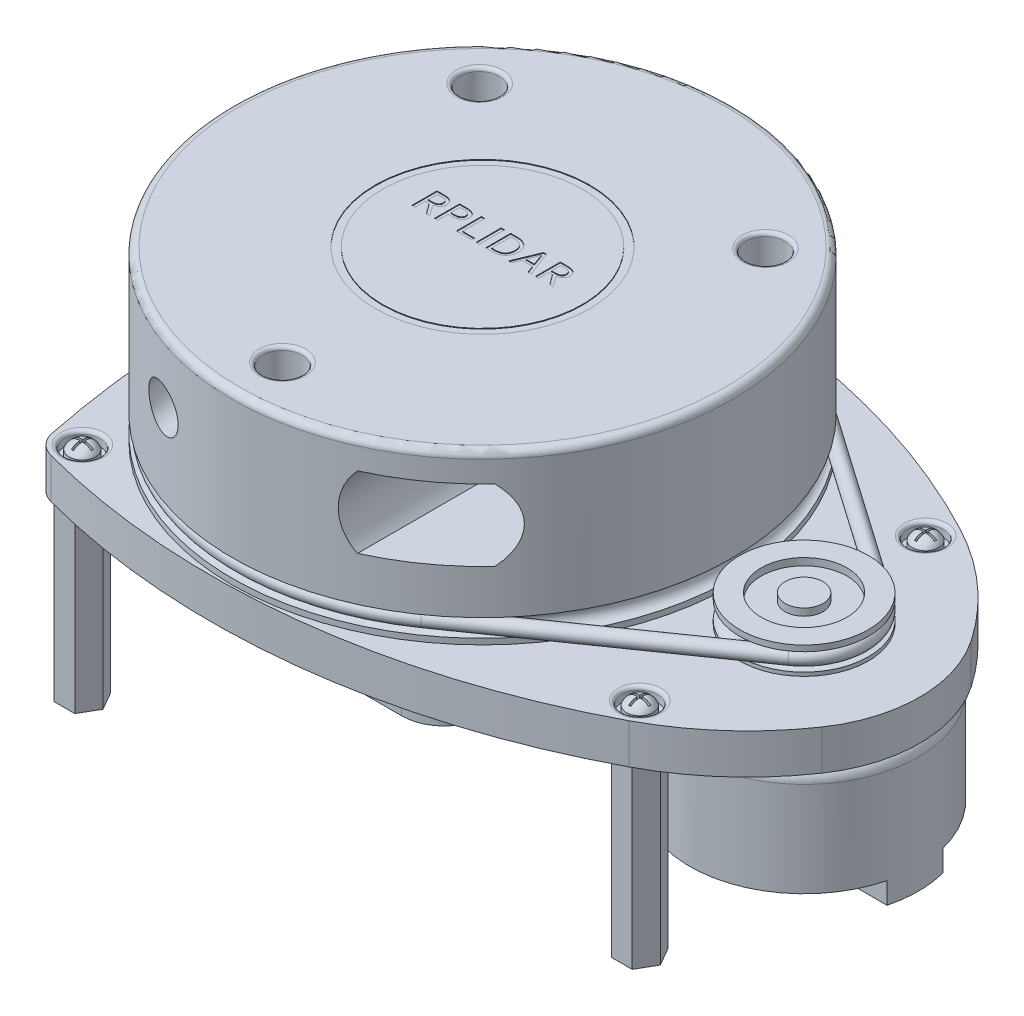
from build123d import *
from build123d.topology import SkipClean

# Parameters (mm, degrees)
SKETCH1_R                   = 35
PUCK_DEPTH                  = 23.5
FILLET1_R                   = 1
CUT_SENSOR_TUNNEL_DEPTH     = 55.792791624
BOSS_BOARD_START            = -0.5
BOSS_BOARD_DEPTH            = 5.6
HEX_STANDOFFS_DEPTH         = 25
SKETCH23_R                  = 2.5
SCREW_SEATS_DEPTH           = 1.5
FILLET_SCREW_SEATS_R        = 0.5
CUT_EXTRUDE5_START          = -0.5
CUT_EXTRUDE5_DEPTH          = 2
SKETCH6_R                   = 16
MOTOR_BODY_DEPTH            = 15
SKETCH9_R                   = 30
MOULD_BOTTOM_DISC_DEPTH     = 3.3
SKETCH10_W                  = 46
SKETCH10_H                  = 57
BOSS_CIRCUIT_DEPTH          = 1.1
FILLET_CIRCUIT_BOARD_R      = 6
SWEEP_BAND_PROFILE_R        = 1
FILLET3_R                   = 1.75
SKETCH18_R                  = 2.75
TOP_PUCK_HOLES_DEPTH        = 8
FILLET_PUCK_HOLES_R         = 0.5
SKETCH19_R                  = 15
SKETCH19_R_2                = 13.98
TOP_RING_AESTHETIC_DEPTH    = 0.1
SKETCH28_W                  = 0.443661972
SKETCH28_H                  = 3.5
RPLIDAR_TEXT_DEPTH          = 0.1
MOTOR_PLASTIC_FEATURE_DEPTH = 3
SKETCH31_R                  = 3.5
CUT_OPTICS_DEPTH            = 78.034465357
CUT_OPTICS_TAPER            = 1
SKETCH37_R                  = 1.25
DRILL_STANDOFFS_DEPTH       = 10


with BuildPart() as part:
    # Sketch1 → puck (new body)
    with BuildSketch(Plane(origin=(0, 0, 0), x_dir=(1, 0, 0), z_dir=(0, 1, 0))):
        Circle(SKETCH1_R)
    extrude(amount=PUCK_DEPTH)

    # Fillet1
    fillet1_edges = [part.edges().sort_by_distance(p)[0] for p in [
        (-35, 23.5, 0),
    ]]
    fillet(fillet1_edges, radius=FILLET1_R)

    # Sketch2 → groove (revolve, cut)
    with BuildSketch(Plane.XY):
        with BuildLine():
            Line((-35, 3.3), (-35, 0.8))
            ThreePointArc((-35, 0.8), (-33.75, 2.05), (-35, 3.3))
        make_face()
    revolve(axis=Axis((0, 0, 0), (0, 1, 0)), mode=Mode.SUBTRACT)

    # Sketch3 → cut_sensor_tunnel (cut, through all)
    with BuildSketch(Plane.XY):
        with BuildLine():
            Line((14.409830056, 19.5), (25.590169944, 19.5))
            ThreePointArc((25.590169944, 19.5), (27.5, 14.5), (25.590169944, 9.5))
            Line((25.590169944, 9.5), (14.409830056, 9.5))
            ThreePointArc((14.409830056, 9.5), (12.5, 14.5), (14.409830056, 19.5))
        make_face()
    extrude(amount=CUT_SENSOR_TUNNEL_DEPTH, mode=Mode.SUBTRACT)



with BuildPart() as body_2:
    # Sketch4 → boss_board (new body)
    with BuildSketch(Plane(origin=(0, 0, 0), x_dir=(1, 0, 0), z_dir=(0, 1, 0)).offset(BOSS_BOARD_START)):
        with BuildLine():
            ThreePointArc((-28.9265577, 31.478719711), (8.165815302, 34.200883889), (43.687550184, 23.179964524))
            ThreePointArc((43.687550184, 23.179964524), (51.581142549, 17.68138932), (57.933651773, 10.457210733))
            ThreePointArc((57.933651773, 10.457210733), (61.172696898, 0), (57.933651773, -10.457210733))
            ThreePointArc((57.933651773, -10.457210733), (51.581142549, -17.68138932), (43.687550184, -23.179964524))
            ThreePointArc((43.687550184, -23.179964524), (8.165815302, -34.200883889), (-28.9265577, -31.478719711))
            ThreePointArc((-28.9265577, -31.478719711), (-30.621991293, -30.466812044), (-31.528712871, -28.712871287))
            ThreePointArc((-31.528712871, -28.712871287), (-34.4, 0), (-31.528712871, 28.712871287))
            ThreePointArc((-31.528712871, 28.712871287), (-30.621991293, 30.466812044), (-28.9265577, 31.478719711))
        make_face()
    extrude(amount=-BOSS_BOARD_DEPTH)

    # Sketch5 → hex_standoffs (add)
    with BuildSketch(Plane.XZ.offset(6.1)):
        Polygon((-26.556624327, 30.5), (-29.443375673, 30.5), (-30.886751346, 28), (-29.443375673, 25.5), (-26.556624327, 25.5), (-25.113248654, 28), align=None)
        Polygon((-26.556624327, -25.5), (-29.443375673, -25.5), (-30.886751346, -28), (-29.443375673, -30.5), (-26.556624327, -30.5), (-25.113248654, -28), align=None)
        Polygon((43.443375673, 22.5), (40.556624327, 22.5), (39.113248654, 20), (40.556624327, 17.5), (43.443375673, 17.5), (44.886751346, 20), align=None)
        Polygon((43.443375673, -17.5), (40.556624327, -17.5), (39.113248654, -20), (40.556624327, -22.5), (43.443375673, -22.5), (44.886751346, -20), align=None)
    extrude(amount=HEX_STANDOFFS_DEPTH)

    # Sketch23 → screw_seats (cut)
    with BuildSketch(Plane(origin=(0, -0.5, 0), x_dir=(1, 0, 0), z_dir=(0, 1, 0))):
        with Locations((-28, 28)):
            Circle(SKETCH23_R)
        with Locations((42, 20)):
            Circle(SKETCH23_R)
        with Locations((42, -20)):
            Circle(SKETCH23_R)
        with Locations((-28, -28)):
            Circle(SKETCH23_R)
    extrude(amount=-SCREW_SEATS_DEPTH, mode=Mode.SUBTRACT)

    # fillet_screw_seats
    fillet_screw_seats_edges = [body_2.edges().sort_by_distance(p)[0] for p in [
        (-30.5, -0.5, 28),
        (39.5, -0.5, 20),
        (39.5, -0.5, -20),
        (-30.5, -0.5, -28),
    ]]
    fillet(fillet_screw_seats_edges, radius=FILLET_SCREW_SEATS_R)

    # Sketch24 → revolve_screw_head (revolve)
    with BuildSketch(Plane.YZ.offset(-28)):
        with BuildLine():
            Line((-2, -28), (-2, -26.15))
            Line((-2, -26.15), (-1.041127656, -26.15))
            ThreePointArc((-1.041127656, -26.15), (-0.28319623, -26.795543768), (0, -27.75))
            Line((0, -27.75), (-1, -27.75))
            Line((-1, -27.75), (-1, -28))
            Line((-1, -28), (-2, -28))
        make_face()
    revolve_screw_head = revolve(axis=Axis((-28, -2, -28), (0, 1, 0)))

    # Sketch25 → Cut-Extrude5 (cut)
    with BuildSketch(Plane(origin=(0, -0.5, 0), x_dir=(1, 0, 0), z_dir=(0, 1, 0)).offset(CUT_EXTRUDE5_START)):
        Polygon((-27.85, 28.15), (-26.6, 28.15), (-26.6, 27.85), (-27.85, 27.85), (-27.85, 26.6), (-28.15, 26.6), (-28.15, 27.85), (-29.4, 27.85), (-29.4, 28.15), (-28.15, 28.15), (-28.15, 29.4), (-27.85, 29.4), align=None)
    cut_extrude5 = extrude(amount=CUT_EXTRUDE5_DEPTH, mode=Mode.SUBTRACT)

    # Sketch-Pattern1: revolve_screw_head, Cut-Extrude5 at 3 more places
    with Locations((70, 0, 8), (70, 0, 48), (0, 0, 56)):
        add(revolve_screw_head)
        add(cut_extrude5, mode=Mode.SUBTRACT)

    # Sketch9 → mould_bottom_disc (add)
    with BuildSketch(Plane.XZ.offset(6.1)):
        Circle(SKETCH9_R)
    extrude(amount=MOULD_BOTTOM_DISC_DEPTH)

    # Sketch10 → boss_circuit (add)
    with BuildSketch(Plane.XZ.offset(9.4)):
        with Locations((0.172696898, 0)):
            Rectangle(SKETCH10_W, SKETCH10_H)
    extrude(amount=BOSS_CIRCUIT_DEPTH)

    # fillet_circuit_board
    fillet_circuit_board_edges = [body_2.edges().sort_by_distance(p)[0] for p in [
        (-22.827303102, -9.95, 28.5),
        (23.172696898, -9.95, -28.5),
        (23.172696898, -9.95, 28.5),
        (-22.827303102, -9.95, -28.5),
    ]]
    fillet(fillet_circuit_board_edges, radius=FILLET_CIRCUIT_BOARD_R)


with BuildPart() as body_3:
    # Sketch6 → motor_body (new body)
    with BuildSketch(Plane.XZ.offset(6.1)):
        with Locations((45, 0)):
            Circle(SKETCH6_R)
    extrude(amount=MOTOR_BODY_DEPTH)

    # Fillet3
    fillet3_edges = [body_3.edges().sort_by_distance(p)[0] for p in [
        (29, -6.1, 0),
    ]]
    fillet(fillet3_edges, radius=FILLET3_R)


    with SkipClean():  # the faces are left unmerged after this step: merging them gives an invalid solid
        add(body_2.part)  # motor_plastic_feature merges body 2
        # Sketch30 → motor_plastic_feature (add)
        with BuildSketch(Plane.XZ.offset(21.1)):
            with BuildLine():
                Line((29.482590422, 3.9), (60.517409578, 3.9))
                ThreePointArc((60.517409578, 3.9), (61, 0), (60.517409578, -3.9))
                Line((60.517409578, -3.9), (29.482590422, -3.9))
                ThreePointArc((29.482590422, -3.9), (29, 0), (29.482590422, 3.9))
            make_face()
        extrude(amount=MOTOR_PLASTIC_FEATURE_DEPTH)

    # Sketch37 → drill_standoffs (cut)
    with SkipClean():  # the faces are left unmerged after this step: merging them gives an invalid solid
        with BuildSketch(Plane.XZ.offset(31.1)):
            with Locations((-28, 28)):
                Circle(SKETCH37_R)
            with Locations((42, 20)):
                Circle(SKETCH37_R)
            with Locations((-28, -28)):
                Circle(SKETCH37_R)
            with Locations((42, -20)):
                Circle(SKETCH37_R)
        extrude(amount=-DRILL_STANDOFFS_DEPTH, mode=Mode.SUBTRACT)


with BuildPart() as body_4:
    # Sketch8 → motor_pulley (revolve)
    with BuildSketch(Plane.XY):
        with BuildLine():
            Line((45, 4.1), (47.65, 4.1))
            Line((47.65, 4.1), (47.65, 3.1))
            Line((47.65, 3.1), (51, 3.1))
            Line((51, 3.1), (51, 4.1))
            Line((51, 4.1), (54, 4.1))
            Line((54, 4.1), (54, 3.283896268))
            ThreePointArc((54, 3.283896268), (52.55, 2.05), (54, 0.816103732))
            Line((54, 0.816103732), (54, 0.3))
            Line((54, 0.3), (47, 0.3))
            Line((47, 0.3), (47, 0))
            Line((47, 0), (45, 0))
            Line((45, 0), (45, 4.1))
        make_face()
    revolve(axis=Axis((45, 0, 0), (0, 1, 0)))


with BuildPart() as part_1:
    add(part.part)

    add(body_4.part)  # sweep_band merges body 4
    # sweep_band: sweep along a path in Sketch12
    with BuildLine(Plane(origin=(0, 2.05, 0), x_dir=(1, 0, 0), z_dir=(0, 1, 0))) as sweep_band_path:
        Line((19.3125, 27.678328052), (49.577777778, 6.560788872))
        ThreePointArc((49.577777778, 6.560788872), (53, 0), (49.577777778, -6.560788872))
        Line((49.577777778, -6.560788872), (19.3125, -27.678328052))
        ThreePointArc((19.3125, -27.678328052), (-33.75, 0), (19.3125, 27.678328052))
    # sweep_band profile (on start of the path) → sweep_band (sweep)
    with BuildSketch(Plane(origin=(19.3125, 2.05, -27.678328052), x_dir=(-0.5722222222222224, 0, 0.8200986089459373), z_dir=(0.8200986089459373, 0, 0.5722222222222224))):
        Circle(SWEEP_BAND_PROFILE_R)
    sweep(path=sweep_band_path.line)

    # Sketch18 → top_puck_holes (cut)
    with BuildSketch(Plane(origin=(0, 23.5, 0), x_dir=(1, 0, 0), z_dir=(0, 1, 0))):
        with Locations((-20, 19.595917942)):
            Circle(SKETCH18_R)
        with Locations((20, 19.595917942)):
            Circle(SKETCH18_R)
        with Locations((0, -28)):
            Circle(SKETCH18_R)
    extrude(amount=-TOP_PUCK_HOLES_DEPTH, mode=Mode.SUBTRACT)

    # fillet_puck_holes
    fillet_puck_holes_edges = [part_1.edges().sort_by_distance(p)[0] for p in [
        (-2.75, 23.5, 28),
        (17.25, 23.5, -19.595917942),
        (-22.75, 23.5, -19.595917942),
    ]]
    fillet(fillet_puck_holes_edges, radius=FILLET_PUCK_HOLES_R)

    # Sketch19 → top_ring_aesthetic (cut)
    with BuildSketch(Plane(origin=(0, 23.5, 0), x_dir=(1, 0, 0), z_dir=(0, 1, 0))):
        Circle(SKETCH19_R)
        Circle(SKETCH19_R_2, mode=Mode.SUBTRACT)
    extrude(amount=-TOP_RING_AESTHETIC_DEPTH, mode=Mode.SUBTRACT)

    # Sketch28 → RPLIDAR_text (cut)
    # profile 1 of 7: a face of its own
    with BuildSketch(Plane(origin=(0, 23.5, 0), x_dir=(1, 0, 0), z_dir=(0, 1, 0))):
        with BuildLine():
            Line((-9.518699354, 1.527961963), (-9.518699354, 0.098384498))
            Line((-9.518699354, 0.098384498), (-9.962361326, 0.098384498))
            Line((-9.962361326, 0.098384498), (-9.962361326, 3.598384498))
            Line((-9.962361326, 3.598384498), (-9.047308509, 3.598384498))
            add(Edge.make_bspline(
                [(-9.047308509, 3.598384498), (-9.010074022, 3.598406733), (-8.938406607, 3.59844953), (-8.835454477, 3.594052816), (-8.741143505, 3.589187689), (-8.629287432, 3.578782879), (-8.500608101, 3.562788655), (-8.402690794, 3.538449911), (-8.355627171, 3.526751576)],
                knots=[0, 0, 0, 0, 0.960912573, 1.849525173, 2.659327608, 3.397884282, 4.749301861, 6, 6, 6, 6], degree=3))
            add(Edge.make_bspline(
                [(-8.355627171, 3.526751576), (-8.32571201, 3.518179413), (-8.267044364, 3.501368252), (-8.182896367, 3.46957633), (-8.103929603, 3.433197836), (-8.030296037, 3.392915875), (-7.962477578, 3.347539331), (-7.899900797, 3.298359484), (-7.842624014, 3.244247606), (-7.791107469, 3.185503936), (-7.744719705, 3.123478914), (-7.705062654, 3.05699123), (-7.671385612, 2.987122817), (-7.643138712, 2.913593713), (-7.622839657, 2.835966663), (-7.607231695, 2.754961093), (-7.597863344, 2.669943095), (-7.596737884, 2.61197871), (-7.596164142, 2.582429393)],
                knots=[0, 0, 0, 0, 1.134140113, 2.224201012, 3.275431843, 4.3018668, 5.280587031, 6.24687456, 7.200337623, 8.148687011, 9.092220061, 10.020068992, 10.966198502, 11.917131199, 12.886677412, 13.887177189, 14.922916719, 16, 16, 16, 16], degree=3))
            add(Edge.make_bspline(
                [(-7.596164142, 2.582429393), (-7.596708206, 2.547714782), (-7.597772295, 2.479819302), (-7.611806916, 2.380968231), (-7.631595192, 2.287193362), (-7.66253987, 2.199922672), (-7.699103041, 2.117905917), (-7.743742684, 2.041835659), (-7.794233427, 1.970683492), (-7.852662405, 1.905951816), (-7.916519288, 1.846214648), (-7.98752068, 1.793148169), (-8.063581708, 1.744207137), (-8.146449252, 1.702193788), (-8.234058967, 1.665367549), (-8.326527306, 1.633842921), (-8.423283666, 1.606327376), (-8.490301937, 1.593685972), (-8.52431115, 1.587270942)],
                knots=[0, 0, 0, 0, 1.112196239, 2.175254001, 3.195927694, 4.180088583, 5.138074931, 6.0714415, 7.003609092, 7.93070943, 8.862804307, 9.803008288, 10.769096889, 11.759573608, 12.777920408, 13.814147618, 14.890763399, 16, 16, 16, 16], degree=3))
            Line((-8.52431115, 1.587270942), (-8.52431115, 1.577257738))
            Line((-8.52431115, 1.577257738), (-7.497572593, 0.098384498))
            Line((-7.497572593, 0.098384498), (-7.941234565, 0.098384498))
            Line((-7.941234565, 0.098384498), (-9.008796185, 1.527961963))
            Line((-9.008796185, 1.527961963), (-9.518699354, 1.527961963))
        make_face()
        with BuildLine():
            Line((-9.518699354, 3.204018301), (-9.518699354, 1.92232816))
            Line((-9.518699354, 1.92232816), (-9.108157981, 1.92232816))
            add(Edge.make_bspline(
                [(-9.108157981, 1.92232816), (-9.077604943, 1.922498152), (-9.018543453, 1.92282676), (-8.933504421, 1.924700236), (-8.855482158, 1.929845279), (-8.762988651, 1.936185347), (-8.657718255, 1.950503729), (-8.57830983, 1.972114046), (-8.540486326, 1.982407386)],
                knots=[0, 0, 0, 0, 0.960008608, 1.855774188, 2.671979062, 3.416289568, 4.769337359, 6, 6, 6, 6], degree=3))
            add(Edge.make_bspline(
                [(-8.540486326, 1.982407386), (-8.505942387, 1.994557563), (-8.439057128, 2.01808319), (-8.34806215, 2.067850302), (-8.269714912, 2.127792201), (-8.203968624, 2.197998884), (-8.150750125, 2.279302119), (-8.115648535, 2.373286011), (-8.092041092, 2.477539389), (-8.090124387, 2.550960175), (-8.089121889, 2.589361611)],
                knots=[0, 0, 0, 0, 1.071897366, 2.075447597, 3.025191329, 3.951603983, 4.882559323, 5.852363215, 6.876716796, 8, 8, 8, 8], degree=3))
            add(Edge.make_bspline(
                [(-8.089121889, 2.589361611), (-8.090561573, 2.625176577), (-8.093324599, 2.693912299), (-8.115315241, 2.791166821), (-8.149790048, 2.877951336), (-8.199465913, 2.952805195), (-8.260469502, 3.017205528), (-8.331379953, 3.07260791), (-8.413259495, 3.117993728), (-8.473353824, 3.138682278), (-8.504284741, 3.149330801)],
                knots=[0, 0, 0, 0, 1.140384521, 2.188614501, 3.161159596, 4.10078681, 5.032829337, 5.977325578, 6.958917162, 8, 8, 8, 8], degree=3))
            add(Edge.make_bspline(
                [(-8.504284741, 3.149330801), (-8.53777504, 3.158218463), (-8.609899374, 3.177358833), (-8.706556395, 3.190130518), (-8.794367396, 3.196598844), (-8.870856519, 3.201671854), (-8.956153478, 3.203533834), (-9.015985239, 3.203851826), (-9.047308509, 3.204018301)],
                knots=[0, 0, 0, 0, 1.138118458, 2.451039163, 3.196085275, 4.033155993, 4.970312991, 6, 6, 6, 6], degree=3))
            Line((-9.047308509, 3.204018301), (-9.518699354, 3.204018301))
        make_face(mode=Mode.SUBTRACT)
    # profile 2 of 7: a face of its own
    with BuildSketch(Plane(origin=(0, 23.5, 0), x_dir=(1, 0, 0), z_dir=(0, 1, 0))):
        with BuildLine():
            Line((-6.363769776, 0.098384498), (-6.807431748, 0.098384498))
            Line((-6.807431748, 0.098384498), (-6.807431748, 3.598384498))
            Line((-6.807431748, 3.598384498), (-5.829988966, 3.598384498))
            add(Edge.make_bspline(
                [(-5.829988966, 3.598384498), (-5.759832174, 3.597462125), (-5.624599428, 3.595684177), (-5.430047049, 3.574869123), (-5.250224094, 3.543768793), (-5.138517514, 3.508439134), (-5.084390375, 3.491320238)],
                knots=[0, 0, 0, 0, 1.112150433, 2.14375761, 3.100562468, 4, 4, 4, 4], degree=3))
            add(Edge.make_bspline(
                [(-5.084390375, 3.491320238), (-5.058575824, 3.481646157), (-5.008119455, 3.462737479), (-4.936236519, 3.429197865), (-4.868812074, 3.393156308), (-4.80617398, 3.353036392), (-4.748500732, 3.308942945), (-4.694848787, 3.262176186), (-4.647159921, 3.210908936), (-4.603868963, 3.156866202), (-4.564937641, 3.099736403), (-4.53185605, 3.03875291), (-4.504449687, 2.974603437), (-4.48055705, 2.907686648), (-4.46358854, 2.837088369), (-4.45015261, 2.763600569), (-4.4423331, 2.686840027), (-4.441606148, 2.634566957), (-4.441234565, 2.607847526)],
                knots=[0, 0, 0, 0, 1.124580066, 2.198071484, 3.23409666, 4.24257832, 5.229550713, 6.194477642, 7.143228582, 8.082444094, 9.018146757, 9.960512637, 10.908395419, 11.862683863, 12.856251848, 13.867396781, 14.909917807, 16, 16, 16, 16], degree=3))
            add(Edge.make_bspline(
                [(-4.441234565, 2.607847526), (-4.442649408, 2.564650906), (-4.445401195, 2.480635961), (-4.464378031, 2.358270788), (-4.498690357, 2.244629703), (-4.545185874, 2.138767882), (-4.604016205, 2.041024195), (-4.67551126, 1.951665438), (-4.759678695, 1.871343048), (-4.854903669, 1.798636997), (-4.961595438, 1.734555355), (-5.079897866, 1.680479949), (-5.20795629, 1.631990759), (-5.347675873, 1.594320408), (-5.4971941, 1.564446554), (-5.656408494, 1.542846751), (-5.825182835, 1.530892617), (-5.940886225, 1.528955318), (-6.000213438, 1.527961963)],
                knots=[0, 0, 0, 0, 0.968750745, 1.884164556, 2.767711883, 3.623640015, 4.470924939, 5.318933496, 6.182267056, 7.073659988, 8.000931356, 8.966940187, 9.987281083, 11.06853522, 12.207958729, 13.405037836, 14.669426411, 16, 16, 16, 16], degree=3))
            add(Edge.make_bspline(
                [(-6.000213438, 1.527961963), (-6.059547033, 1.528658581), (-6.180888037, 1.530083211), (-6.301920193, 1.538874426), (-6.363769776, 1.543366893)],
                knots=[0, 0, 0, 0, 0.977964451, 2, 2, 2, 2], degree=3))
            Line((-6.363769776, 1.543366893), (-6.363769776, 0.098384498))
        make_face()
        with BuildLine():
            add(Edge.make_bspline(
                [(-6.363769776, 1.943124815), (-6.33502979, 1.939900299), (-6.276603836, 1.933345132), (-6.18826656, 1.926148828), (-6.100870788, 1.923763732), (-6.043346986, 1.922795084), (-6.015618368, 1.92232816)],
                knots=[0, 0, 0, 0, 0.994453465, 2.021639473, 3.046356417, 4, 4, 4, 4], degree=3))
            add(Edge.make_bspline(
                [(-6.015618368, 1.92232816), (-5.968621978, 1.922955195), (-5.878143099, 1.92416238), (-5.748006844, 1.932306738), (-5.628691642, 1.94694808), (-5.519862599, 1.96683273), (-5.420638296, 1.991552563), (-5.332023761, 2.023885628), (-5.251678173, 2.058306843), (-5.181712887, 2.100638569), (-5.120527211, 2.147473948), (-5.068242641, 2.199372214), (-5.025448095, 2.256316227), (-4.991075903, 2.317687061), (-4.965916191, 2.384060302), (-4.947195186, 2.45447369), (-4.93652378, 2.52947182), (-4.934980054, 2.580856402), (-4.934192312, 2.60707728)],
                knots=[0, 0, 0, 0, 1.553856939, 2.991532652, 4.308749893, 5.52587743, 6.647999125, 7.684421496, 8.642023654, 9.533004122, 10.380289066, 11.184640834, 11.960536732, 12.728168995, 13.50220512, 14.301118221, 15.133082931, 16, 16, 16, 16], degree=3))
            add(Edge.make_bspline(
                [(-4.934192312, 2.60707728), (-4.935344719, 2.638997031), (-4.937557527, 2.700288103), (-4.955224548, 2.787822562), (-4.985604993, 2.866175802), (-5.027704336, 2.935711812), (-5.08132944, 2.996667767), (-5.144745351, 3.049744411), (-5.218341055, 3.095433512), (-5.272720399, 3.117762376), (-5.300829635, 3.129304393)],
                knots=[0, 0, 0, 0, 1.117778909, 2.146315848, 3.111871591, 4.048326347, 4.979190795, 5.943236808, 6.93683817, 8, 8, 8, 8], degree=3))
            add(Edge.make_bspline(
                [(-5.300829635, 3.129304393), (-5.339832016, 3.142243548), (-5.421897676, 3.169469075), (-5.532315897, 3.185215759), (-5.628306414, 3.195441172), (-5.707971757, 3.200670212), (-5.793503784, 3.203788672), (-5.852579673, 3.203940019), (-5.883135973, 3.204018301)],
                knots=[0, 0, 0, 0, 1.251428429, 2.633154656, 3.389182658, 4.197833418, 5.067850789, 6, 6, 6, 6], degree=3))
            Line((-5.883135973, 3.204018301), (-6.363769776, 3.204018301))
            Line((-6.363769776, 3.204018301), (-6.363769776, 1.943124815))
        make_face(mode=Mode.SUBTRACT)
    # profile 3 of 7: a face of its own
    with BuildSketch(Plane(origin=(0, 23.5, 0), x_dir=(1, 0, 0), z_dir=(0, 1, 0))):
        Polygon((-3.307431748, 3.598384498), (-3.307431748, 0.492750695), (-1.609808509, 0.492750695), (-1.609808509, 0.098384498), (-3.75109372, 0.098384498), (-3.75109372, 3.598384498), align=None)
    # profile 4 of 7: a face of its own
    with BuildSketch(Plane(origin=(0, 23.5, 0), x_dir=(1, 0, 0), z_dir=(0, 1, 0))):
        with Locations((-0.768699354, 1.848384498)):
            Rectangle(SKETCH28_W, SKETCH28_H)
    # profile 5 of 7: a face of its own
    with BuildSketch(Plane(origin=(0, 23.5, 0), x_dir=(1, 0, 0), z_dir=(0, 1, 0))):
        with BuildLine():
            add(Edge.make_bspline(
                [(3.150314731, 1.863789428), (3.149443844, 1.81343591), (3.147729768, 1.714330345), (3.13364302, 1.567840472), (3.109742173, 1.426064449), (3.076696044, 1.288832021), (3.034765887, 1.157298039), (2.982646364, 1.032098058), (2.921286243, 0.913698592), (2.850119864, 0.801865378), (2.768680253, 0.698114115), (2.67935871, 0.599815976), (2.578432809, 0.511124042), (2.469872483, 0.428119532), (2.351486307, 0.353672902), (2.222768364, 0.289655411), (2.085550219, 0.231519198), (1.988833616, 0.202015897), (1.939487266, 0.186962843)],
                knots=[0, 0, 0, 0, 1.078960079, 2.123604343, 3.150299665, 4.15788564, 5.14625318, 6.105773375, 7.060644044, 8.000881039, 8.941922687, 9.884282479, 10.842950369, 11.816876698, 12.810727448, 13.834395753, 14.895074244, 16, 16, 16, 16], degree=3))
            add(Edge.make_bspline(
                [(1.939487266, 0.186962843), (1.879630349, 0.171991893), (1.755831702, 0.141028331), (1.559399033, 0.115028184), (1.347914106, 0.100701746), (1.201874485, 0.099176051), (1.126106984, 0.098384498)],
                knots=[0, 0, 0, 0, 0.901624692, 1.864778919, 2.892215929, 4, 4, 4, 4], degree=3))
            Line((1.126106984, 0.098384498), (0.340455576, 0.098384498))
            Line((0.340455576, 0.098384498), (0.340455576, 3.598384498))
            Line((0.340455576, 3.598384498), (1.133809449, 3.598384498))
            add(Edge.make_bspline(
                [(1.133809449, 3.598384498), (1.209587801, 3.597718191), (1.355666633, 3.596433743), (1.566989149, 3.580431552), (1.763605875, 3.556025832), (1.887344943, 3.524872875), (1.947189731, 3.509806153)],
                knots=[0, 0, 0, 0, 1.107853918, 2.135623218, 3.09831846, 4, 4, 4, 4], degree=3))
            add(Edge.make_bspline(
                [(1.947189731, 3.509806153), (1.996512154, 3.494691918), (2.093088117, 3.46509743), (2.230450728, 3.407918313), (2.359178447, 3.344668763), (2.477323604, 3.270921469), (2.585789033, 3.189732734), (2.686479047, 3.103116464), (2.77461477, 3.00664934), (2.854733267, 2.904742967), (2.924698099, 2.795709248), (2.986149585, 2.680564615), (3.036859258, 2.558132262), (3.078265377, 2.429524041), (3.110546691, 2.295347556), (3.133556524, 2.156096754), (3.14776804, 2.011716668), (3.149456655, 1.913631655), (3.150314731, 1.863789428)],
                knots=[0, 0, 0, 0, 1.119747129, 2.192525263, 3.227419251, 4.231648869, 5.211937959, 6.16820741, 7.111232784, 8.044847219, 8.980607305, 9.92100777, 10.875812919, 11.85449892, 12.852610337, 13.870158293, 14.917713832, 16, 16, 16, 16], degree=3))
        make_face()
        with BuildLine():
            add(Edge.make_bspline(
                [(2.706652759, 1.863789428), (2.70615446, 1.904635136), (2.705181334, 1.984402598), (2.694865878, 2.101199204), (2.678394012, 2.211946807), (2.654138553, 2.316590364), (2.624326276, 2.415620836), (2.5876464, 2.508851932), (2.543293793, 2.595879037), (2.492257243, 2.676897555), (2.435317254, 2.752411649), (2.372435204, 2.822241928), (2.303866087, 2.886476418), (2.228654323, 2.944100931), (2.148192107, 2.996864802), (2.061896496, 3.043719699), (1.969684872, 3.084940398), (1.905267683, 3.107193102), (1.872475822, 3.118520942)],
                knots=[0, 0, 0, 0, 1.203903872, 2.351100332, 3.453730805, 4.502185143, 5.515033583, 6.500355373, 7.451594309, 8.390343524, 9.319861882, 10.23637587, 11.157535359, 12.085634934, 13.0261829, 13.991531864, 14.977580239, 16, 16, 16, 16], degree=3))
            add(Edge.make_bspline(
                [(1.872475822, 3.118520942), (1.846098914, 3.12621812), (1.792155586, 3.141959593), (1.708415315, 3.161193071), (1.619896043, 3.175794294), (1.52675616, 3.185961727), (1.428432891, 3.194922585), (1.324344381, 3.199540202), (1.214210288, 3.204076486), (1.138693385, 3.204038041), (1.099918604, 3.204018301)],
                knots=[0, 0, 0, 0, 0.845083279, 1.728277009, 2.64102572, 3.603014072, 4.609768268, 5.677380585, 6.807431769, 8, 8, 8, 8], degree=3))
            Line((1.099918604, 3.204018301), (0.784117548, 3.204018301))
            Line((0.784117548, 3.204018301), (0.784117548, 0.492750695))
            Line((0.784117548, 0.492750695), (1.099918604, 0.492750695))
            add(Edge.make_bspline(
                [(1.099918604, 0.492750695), (1.138692446, 0.492741284), (1.214207521, 0.492722954), (1.32435454, 0.497117049), (1.428376802, 0.502229902), (1.526864648, 0.509483949), (1.619829108, 0.521296992), (1.708424566, 0.535493596), (1.792153419, 0.554828683), (1.846098202, 0.570557208), (1.872475822, 0.578248055)],
                knots=[0, 0, 0, 0, 1.192525158, 2.322535528, 3.390109286, 4.396176414, 5.359069667, 6.271785412, 7.154947244, 8, 8, 8, 8], degree=3))
            add(Edge.make_bspline(
                [(1.872475822, 0.578248055), (1.905295054, 0.589513062), (1.96986564, 0.611676535), (2.061890396, 0.653901528), (2.14840877, 0.701401076), (2.228959152, 0.75572101), (2.303595628, 0.815826345), (2.37303251, 0.88149798), (2.435028726, 0.954450949), (2.492527668, 1.032329726), (2.543515195, 1.116532028), (2.587280139, 1.20688291), (2.624381401, 1.302721063), (2.65412504, 1.404084377), (2.678305021, 1.510783019), (2.694876588, 1.623302249), (2.705176048, 1.741639029), (2.706152762, 1.822430749), (2.706652759, 1.863789428)],
                knots=[0, 0, 0, 0, 1.006667003, 1.98057894, 2.934641552, 3.868938456, 4.796583139, 5.713780668, 6.638546881, 7.571683814, 8.52134086, 9.491281069, 10.482238571, 11.500889964, 12.554993275, 13.655371902, 14.799744318, 16, 16, 16, 16], degree=3))
        make_face(mode=Mode.SUBTRACT)
    # profile 6 of 7: a face of its own
    with BuildSketch(Plane(origin=(0, 23.5, 0), x_dir=(1, 0, 0), z_dir=(0, 1, 0))):
        Polygon((3.533127231, 0.098384498), (4.974258393, 3.598384498), (5.319328815, 3.598384498), (6.716555928, 0.098384498), (6.255948534, 0.098384498), (5.876217019, 1.133595766), (4.385019836, 1.133595766), (3.9883429, 0.098384498), align=None)
        with BuildLine():
            add(Edge.make_bspline(
                [(5.122145717, 3.056130977), (5.081045492, 2.94907454), (5.000827017, 2.740124245), (4.883899219, 2.434535785), (4.772820012, 2.144373935), (4.700578637, 1.956213449), (4.665389555, 1.864559674)],
                knots=[0, 0, 0, 0, 1.078349399, 2.104697591, 3.07679012, 4, 4, 4, 4], degree=3))
            Line((4.665389555, 1.864559674), (4.535988146, 1.527961963))
            Line((4.535988146, 1.527961963), (5.732180928, 1.527961963))
            Line((5.732180928, 1.527961963), (5.607400998, 1.866100167))
            add(Edge.make_bspline(
                [(5.607400998, 1.866100167), (5.57359919, 1.959075847), (5.504466408, 2.149233351), (5.396738013, 2.440212045), (5.286646829, 2.744435928), (5.210332616, 2.950908674), (5.171441491, 3.056130977)],
                knots=[0, 0, 0, 0, 0.936701532, 1.915778694, 2.937842541, 4, 4, 4, 4], degree=3))
            Line((5.171441491, 3.056130977), (5.122145717, 3.056130977))
        make_face(mode=Mode.SUBTRACT)
    # profile 7 of 7: a face of its own
    with BuildSketch(Plane(origin=(0, 23.5, 0), x_dir=(1, 0, 0), z_dir=(0, 1, 0))):
        with BuildLine():
            Line((7.734821773, 1.527961963), (7.734821773, 0.098384498))
            Line((7.734821773, 0.098384498), (7.291159801, 0.098384498))
            Line((7.291159801, 0.098384498), (7.291159801, 3.598384498))
            Line((7.291159801, 3.598384498), (8.206212618, 3.598384498))
            add(Edge.make_bspline(
                [(8.206212618, 3.598384498), (8.243447105, 3.598406733), (8.31511452, 3.59844953), (8.418066649, 3.594052816), (8.512377622, 3.589187689), (8.624233695, 3.578782879), (8.752913026, 3.562788655), (8.850830333, 3.538449911), (8.897893956, 3.526751576)],
                knots=[0, 0, 0, 0, 0.960912573, 1.849525173, 2.659327608, 3.397884282, 4.749301861, 6, 6, 6, 6], degree=3))
            add(Edge.make_bspline(
                [(8.897893956, 3.526751576), (8.927809117, 3.518179413), (8.986476763, 3.501368252), (9.07062476, 3.46957633), (9.149591524, 3.433197836), (9.22322509, 3.392915875), (9.291043549, 3.347539331), (9.353620329, 3.298359484), (9.410897113, 3.244247606), (9.462413658, 3.185503936), (9.508801421, 3.123478914), (9.548458472, 3.05699123), (9.582135515, 2.987122817), (9.610382414, 2.913593713), (9.63068147, 2.835966663), (9.646289431, 2.754961093), (9.655657782, 2.669943095), (9.656783243, 2.61197871), (9.657356984, 2.582429393)],
                knots=[0, 0, 0, 0, 1.134140113, 2.224201012, 3.275431843, 4.3018668, 5.280587031, 6.24687456, 7.200337623, 8.148687011, 9.092220061, 10.020068992, 10.966198502, 11.917131199, 12.886677412, 13.887177189, 14.922916719, 16, 16, 16, 16], degree=3))
            add(Edge.make_bspline(
                [(9.657356984, 2.582429393), (9.656812921, 2.547714782), (9.655748831, 2.479819302), (9.641714211, 2.380968231), (9.621925935, 2.287193362), (9.590981257, 2.199922672), (9.554418086, 2.117905917), (9.509778442, 2.041835659), (9.459287699, 1.970683492), (9.400858722, 1.905951816), (9.337001839, 1.846214648), (9.266000447, 1.793148169), (9.189939419, 1.744207137), (9.107071875, 1.702193788), (9.01946216, 1.665367549), (8.92699382, 1.633842921), (8.830237461, 1.606327376), (8.76321919, 1.593685972), (8.729209977, 1.587270942)],
                knots=[0, 0, 0, 0, 1.112196239, 2.175254001, 3.195927694, 4.180088583, 5.138074931, 6.0714415, 7.003609092, 7.93070943, 8.862804307, 9.803008288, 10.769096889, 11.759573608, 12.777920408, 13.814147618, 14.890763399, 16, 16, 16, 16], degree=3))
            Line((8.729209977, 1.587270942), (8.729209977, 1.577257738))
            Line((8.729209977, 1.577257738), (9.755948534, 0.098384498))
            Line((9.755948534, 0.098384498), (9.312286562, 0.098384498))
            Line((9.312286562, 0.098384498), (8.244724942, 1.527961963))
            Line((8.244724942, 1.527961963), (7.734821773, 1.527961963))
        make_face()
        with BuildLine():
            Line((7.734821773, 3.204018301), (7.734821773, 1.92232816))
            Line((7.734821773, 1.92232816), (8.145363146, 1.92232816))
            add(Edge.make_bspline(
                [(8.145363146, 1.92232816), (8.175916184, 1.922498152), (8.234977674, 1.92282676), (8.320016705, 1.924700236), (8.398038969, 1.929845279), (8.490532476, 1.936185347), (8.595802872, 1.950503729), (8.675211297, 1.972114046), (8.713034801, 1.982407386)],
                knots=[0, 0, 0, 0, 0.960008608, 1.855774188, 2.671979062, 3.416289568, 4.769337359, 6, 6, 6, 6], degree=3))
            add(Edge.make_bspline(
                [(8.713034801, 1.982407386), (8.747578739, 1.994557563), (8.814463999, 2.01808319), (8.905458977, 2.067850302), (8.983806215, 2.127792201), (9.049552502, 2.197998884), (9.102771002, 2.279302119), (9.137872591, 2.373286011), (9.161480034, 2.477539389), (9.163396739, 2.550960175), (9.164399238, 2.589361611)],
                knots=[0, 0, 0, 0, 1.071897366, 2.075447597, 3.025191329, 3.951603983, 4.882559323, 5.852363215, 6.876716796, 8, 8, 8, 8], degree=3))
            add(Edge.make_bspline(
                [(9.164399238, 2.589361611), (9.162959554, 2.625176577), (9.160196528, 2.693912299), (9.138205885, 2.791166821), (9.103731079, 2.877951336), (9.054055214, 2.952805195), (8.993051625, 3.017205528), (8.922141174, 3.07260791), (8.840261631, 3.117993728), (8.780167303, 3.138682278), (8.749236386, 3.149330801)],
                knots=[0, 0, 0, 0, 1.140384521, 2.188614501, 3.161159596, 4.10078681, 5.032829337, 5.977325578, 6.958917162, 8, 8, 8, 8], degree=3))
            add(Edge.make_bspline(
                [(8.749236386, 3.149330801), (8.715746086, 3.158218463), (8.643621753, 3.177358833), (8.546964732, 3.190130518), (8.459153731, 3.196598844), (8.382664607, 3.201671854), (8.297367648, 3.203533834), (8.237535888, 3.203851826), (8.206212618, 3.204018301)],
                knots=[0, 0, 0, 0, 1.138118458, 2.451039163, 3.196085275, 4.033155993, 4.970312991, 6, 6, 6, 6], degree=3))
            Line((8.206212618, 3.204018301), (7.734821773, 3.204018301))
        make_face(mode=Mode.SUBTRACT)
    extrude(amount=-RPLIDAR_TEXT_DEPTH, mode=Mode.SUBTRACT)

    # Sketch31 → cut_optics (cut, through all)
    with BuildSketch(Plane(origin=(0, 0, 0), x_dir=(0, -1, 0), z_dir=(0.17364817766693072, 0, 0.984807753012208))):
        with Locations((-14.5, -17.390175692)):
            Circle(SKETCH31_R)
    extrude(amount=CUT_OPTICS_DEPTH, taper=CUT_OPTICS_TAPER, mode=Mode.SUBTRACT)


solid = Compound([body_3.part, part_1.part])
